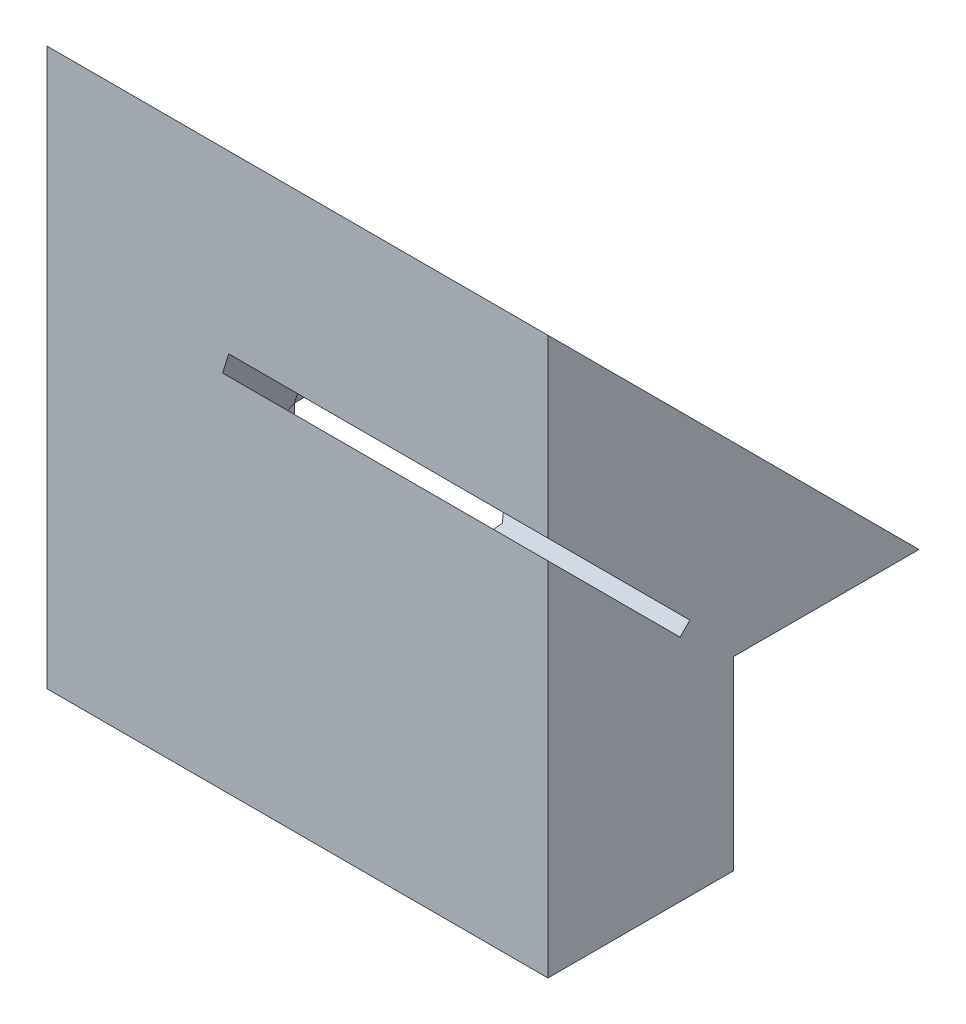
from build123d import *

# Parameters (mm, degrees)
SKETCH1_W           = 50
SKETCH1_H           = 20
BOSS_EXTRUDE1_DEPTH = 10
CUT_EXTRUDE1_DEPTH  = 0.375
BOSS_EXTRUDE3_DEPTH = 10
BOSS_EXTRUDE4_DEPTH = 10
SKETCH5_W           = 25.687022838
SKETCH5_H           = 30.894675689
CUT_EXTRUDE3_DEPTH  = 41.311288741
CUT_EXTRUDE4_DEPTH  = 36.057096286
FILLET1_R           = 2
FILLET2_R           = 2


with BuildPart() as part:
    # Sketch1 → Boss-Extrude1 (new body)
    with BuildSketch(Plane.XY):
        Rectangle(SKETCH1_W, SKETCH1_H)
    extrude(amount=BOSS_EXTRUDE1_DEPTH)

    # Sketch2 → Cut-Extrude1 (cut, symmetric)
    with BuildSketch(Plane(origin=(0, -5, 5), x_dir=(1, 0, 0), z_dir=(0, -0.7071067811865464, 0.7071067811865488))):
        Polygon((-23, -10.071067812), (35.375550351, 5.570613762), (29.163893269, 28.752833593), (-10.439065609, 18.141252744), align=None)
    extrude(amount=CUT_EXTRUDE1_DEPTH, both=True, mode=Mode.SUBTRACT)

    # Sketch3 → Boss-Extrude3 (add)
    with BuildSketch(Plane.XZ.offset(10)):
        Polygon((-25, 0), (-21.664313944, 0), (-21.497353187, 0.530330086), (-10.404328524, 0.530330086), (-11.803847577, 0), (25, 0), (25, 10), (-25, 10), align=None)
    extrude(amount=BOSS_EXTRUDE3_DEPTH)

    # Sketch4 → Boss-Extrude4 (add)
    with BuildSketch(Plane(origin=(0, 0, 0), x_dir=(-1, 0, 0), z_dir=(0, 0, -1))):
        Polygon((10.404328524, -9.469669914), (21.497353187, -9.469669914), (21.664313944, -10), (25, -10), (25, 10), (-25, 10), (-25, -10), (11.803847577, -10), align=None)
    extrude(amount=BOSS_EXTRUDE4_DEPTH)

    # Sketch5 → Cut-Extrude3 (cut, through all)
    with BuildSketch(Plane.XZ.offset(20)):
        with Locations((14.843511419, 0.908787841)):
            Rectangle(SKETCH5_W, SKETCH5_H)
    extrude(amount=-CUT_EXTRUDE3_DEPTH, mode=Mode.SUBTRACT)

    # Sketch6 → Cut-Extrude4 (cut, through all)
    with BuildSketch(Plane(origin=(2, 0, 0), x_dir=(0, 0, -1), z_dir=(1, 0, 0))):
        Polygon((-10, 10), (10, -10), (10, 10), align=None)
    extrude(amount=-CUT_EXTRUDE4_DEPTH, mode=Mode.SUBTRACT)

    # Fillet1
    # the kernel refuses this fillet: 2 mm, written as the material it takes off along each edge
    with BuildSketch(Plane(origin=(-11.803847577, -10, 0), x_dir=(1, 0, 0), z_dir=(0, 0, -1))) as fillet1_piece_1:
        with BuildLine():
            CenterArc((2.756010978, -2), FILLET1_R, 90, 42.706727968)
            Line((1.399519053, -0.530330086), (0, 0))
            Line((0, 0), (2.756010978, 0))
        make_face()
    extrude(amount=16.890027445, mode=Mode.SUBTRACT)

    # Fillet2
    # the kernel refuses this fillet: 2 mm, written as the material it takes off along each edge
    with BuildSketch(Plane(origin=(-11.803847577, -3.109972555, 0), x_dir=(1, 0, 0), z_dir=(0, -1, 0))) as fillet2_piece_1_section:
        with BuildLine():
            CenterArc((2.756010978, 2), FILLET2_R, 227.293272032, 42.706727968)
            Line((1.399519053, 0.530330086), (0, 0))
            Line((0, 0), (2.756010978, 0))
        make_face()
    fillet2_piece_1 = extrude(amount=23.780054891, mode=Mode.PRIVATE)
    fillet2_piece_1 = split(fillet2_piece_1, bisect_by=Plane(origin=(-9.777530732, -9.469669914, 0.133569591), z_dir=(0, -1, 0)), keep=Keep.TOP, mode=Mode.PRIVATE)
    fillet2_piece_1 = fillet2_piece_1 - Plane(origin=(-9.047836599, -8, 0.133569591), x_dir=(1, 0, 0), z_dir=(0, 0, 1)) * Cylinder(2, 59, mode=Mode.PRIVATE)
    add(fillet2_piece_1, mode=Mode.SUBTRACT)


solid = part.part
